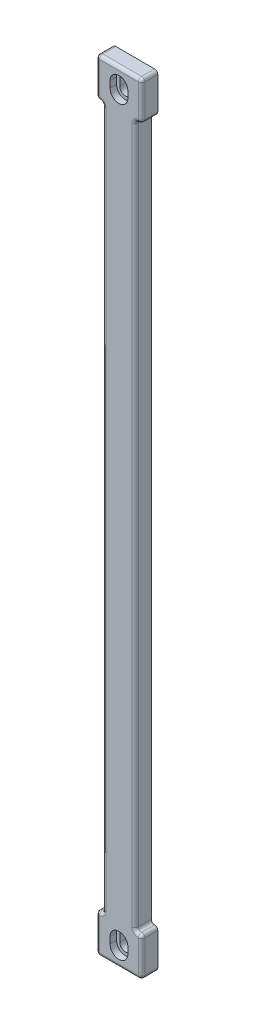
from build123d import *

# Parameters (mm, degrees)
SKETCH1_W           = 14
SKETCH1_H           = 241
BOSS_EXTRUDE1_DEPTH = 5
CUT_EXTRUDE3_REACH  = 243.458
SKETCH4_W           = 2
SKETCH4_H           = 217
CUT_EXTRUDE1_DEPTH  = 242.458070894
CUT_EXTRUDE2_DEPTH  = 2
FILLET1_R           = 1


with BuildPart() as part:
    # Sketch1 → Boss-Extrude1 (new body)
    with BuildSketch(Plane.XY):
        with Locations((7, 120.5)):
            Rectangle(SKETCH1_W, SKETCH1_H)
    extrude(amount=BOSS_EXTRUDE1_DEPTH)

    # Sketch4 → Cut-Extrude3 (cut, up to next)
    with BuildSketch(Plane.XY.offset(5), mode=Mode.PRIVATE) as cut_extrude3_sk1:
        with Locations((1, 120.5)):
            Rectangle(SKETCH4_W, SKETCH4_H)
    cut_extrude3_tool1 = extrude(cut_extrude3_sk1.sketch, amount=-CUT_EXTRUDE3_REACH, mode=Mode.PRIVATE) & part.part
    # Sketch4 → Cut-Extrude3 (cut, up to next)
    with BuildSketch(Plane.XY.offset(5), mode=Mode.PRIVATE) as cut_extrude3_sk2:
        with Locations((13, 120.5)):
            Rectangle(SKETCH4_W, SKETCH4_H)
    cut_extrude3_tool2 = extrude(cut_extrude3_sk2.sketch, amount=-CUT_EXTRUDE3_REACH, mode=Mode.PRIVATE) & part.part
    add(cut_extrude3_tool1.solids().sort_by_distance((1, 120.5, 5))[0], mode=Mode.SUBTRACT)
    add(cut_extrude3_tool2.solids().sort_by_distance((13, 120.5, 5))[0], mode=Mode.SUBTRACT)

    # Sketch2 → Cut-Extrude1 (cut, through all)
    with BuildSketch(Plane.XY.offset(5)):
        with BuildLine():
            Line((8.75, 7), (8.75, 5))
            ThreePointArc((8.75, 5), (7, 3.25), (5.25, 5))
            Line((5.25, 5), (5.25, 7))
            ThreePointArc((5.25, 7), (7, 8.75), (8.75, 7))
        make_face()
        with BuildLine():
            Line((8.75, 236), (8.75, 234))
            ThreePointArc((8.75, 234), (7, 232.25), (5.25, 234))
            Line((5.25, 234), (5.25, 236))
            ThreePointArc((5.25, 236), (7, 237.75), (8.75, 236))
        make_face()
    extrude(amount=-CUT_EXTRUDE1_DEPTH, mode=Mode.SUBTRACT)

    # Sketch3 → Cut-Extrude2 (cut)
    with BuildSketch(Plane.XY.offset(5)):
        with BuildLine():
            Line((9.75, 7), (9.75, 5))
            ThreePointArc((9.75, 5), (7, 2.25), (4.25, 5))
            Line((4.25, 5), (4.25, 7))
            ThreePointArc((4.25, 7), (7, 9.75), (9.75, 7))
        make_face()
        with BuildLine():
            Line((9.75, 236), (9.75, 234))
            ThreePointArc((9.75, 234), (7, 231.25), (4.25, 234))
            Line((4.25, 234), (4.25, 236))
            ThreePointArc((4.25, 236), (7, 238.75), (9.75, 236))
        make_face()
    extrude(amount=-CUT_EXTRUDE2_DEPTH, mode=Mode.SUBTRACT)

    # Fillet1
    fillet1_edges = [part.edges().sort_by_distance(p)[0] for p in [
        (2, 229, 2.5),
        (12, 229, 2.5),
        (12, 12, 2.5),
        (2, 12, 2.5),
    ]]
    fillet(fillet1_edges, radius=FILLET1_R)
    fillet1_2_edges = [part.edges().sort_by_distance(p)[0] for p in [
        (0, 241, 2.5),
        (14, 241, 2.5),
        (7, 241, 5),
        (14, 6, 5),
        (14, 235, 5),
        (0, 6, 5),
        (0, 235, 5),
        (7, 0, 5),
        (0, 0, 2.5),
        (14, 0, 2.5),
        (0, 229, 2.5),
        (14, 229, 2.5),
        (12, 120.5, 5),
        (14, 12, 2.5),
        (2, 120.5, 5),
        (0, 12, 2.5),
        (1.707106781, 228.707106781, 5),
        (1.707106781, 12.292893219, 5),
        (12.292893219, 228.707106781, 5),
        (12.292893219, 12.292893219, 5),
    ]]
    fillet(fillet1_2_edges, radius=FILLET1_R - 0.0001)  # a hair under: the kernel refuses the full size


solid = part.part
